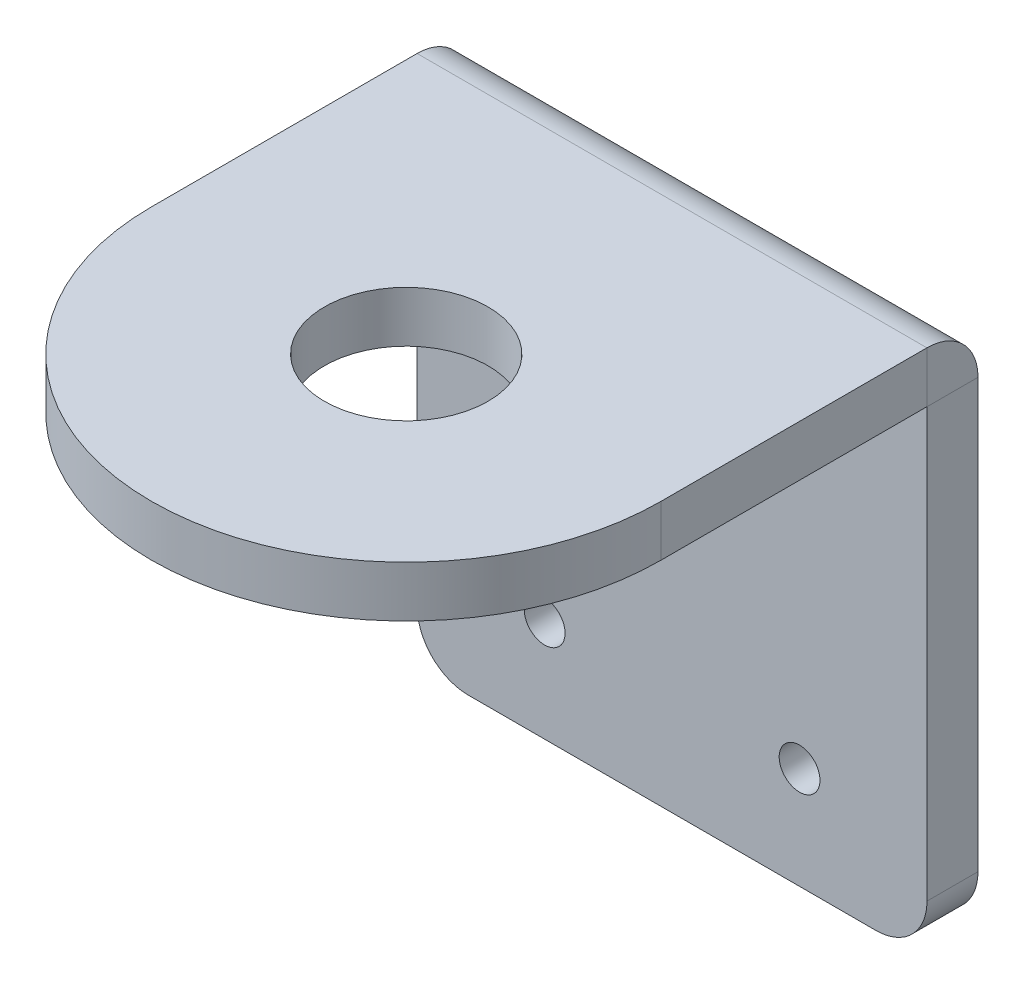
from build123d import *

# Parameters (mm, degrees)
SCHIZZO1_R                           = 8.025
SCHIZZO1_R_2                         = 2
BASE_FLANGIA1_DEPTH                  = 5
PIEGATURA_START                      = -25
PIEGATURA_DELLO_SCHIZZO1_OUTLINE_W   = 50
PIEGATURA_DELLO_SCHIZZO1_OUTLINE_H   = 5
PIEGATURA_DELLO_SCHIZZO1_DEPTH       = 51
PIEGATURA_START_2                    = -30
PIEGATURA_DELLO_SCHIZZO1_2_OUTLINE_R = 8.025
PIEGATURA_DELLO_SCHIZZO1_2_DEPTH     = 5
PIEGATURA_START_3                    = -26
PIEGATURA_DELLO_SCHIZZO1_3_DEPTH     = 51
PIEGATURA_DELLO_SCHIZZO1_4_DEPTH     = 50


with BuildPart() as part:
    # Base-Flangia1: sheet metal written as solids
    # Schizzo1 → Base-Flangia1 (new body)
    with BuildSketch(Plane.XY):
        with BuildLine():
            Line((-25, -72), (-25, 0))
            ThreePointArc((-25, 0), (0, 25), (25, 0))
            Line((25, 0), (25, -72))
            ThreePointArc((25, -72), (23.535533906, -75.535533906), (20, -77))
            Line((20, -77), (-20, -77))
            ThreePointArc((-20, -77), (-23.535533906, -75.535533906), (-25, -72))
        make_face()
        Circle(SCHIZZO1_R, mode=Mode.SUBTRACT)
        with Locations((-12.5, -67)):
            Circle(SCHIZZO1_R_2, mode=Mode.SUBTRACT)
        with Locations((12.5, -67)):
            Circle(SCHIZZO1_R_2, mode=Mode.SUBTRACT)
    extrude(amount=-BASE_FLANGIA1_DEPTH)

    # Piegatura dello schizzo1: read off the stored shape, not the designer's step
    # Piegatura dello schizzo1 outline → Piegatura dello schizzo1 (cut)
    with BuildSketch(Plane(origin=(0, 0, 0), x_dir=(1, 0, 0), z_dir=(0, 1, 0)).offset(PIEGATURA_START)):
        with Locations((0, 2.5)):
            Rectangle(PIEGATURA_DELLO_SCHIZZO1_OUTLINE_W, PIEGATURA_DELLO_SCHIZZO1_OUTLINE_H)
    extrude(amount=PIEGATURA_DELLO_SCHIZZO1_DEPTH, mode=Mode.SUBTRACT)

    # Piegatura dello schizzo1 2 outline → Piegatura dello schizzo1 2 (add)
    with BuildSketch(Plane(origin=(0, 0, 0), x_dir=(1, 0, 0), z_dir=(0, 1, 0)).offset(PIEGATURA_START_2)):
        with BuildLine():
            Line((-25, 0), (-25, -26.07730122))
            ThreePointArc((-25, -26.07730122), (0, -51.07730122), (25, -26.07730122))
            Line((25, -26.07730122), (25, 0))
            Line((25, 0), (-25, 0))
        make_face()
        with Locations((0, -26.07730122)):
            Circle(PIEGATURA_DELLO_SCHIZZO1_2_OUTLINE_R, mode=Mode.SUBTRACT)
    extrude(amount=PIEGATURA_DELLO_SCHIZZO1_2_DEPTH)

    # Piegatura dello schizzo1 3 outline → Piegatura dello schizzo1 3 (cut)
    with BuildSketch(Plane.YZ.offset(PIEGATURA_START_3)):
        with BuildLine():
            ThreePointArc((-25, 0.01), (-26.467395026, -3.532604974), (-30.01, -5))
            Line((-30.01, -5), (-25, -5))
            Line((-25, -5), (-25, 0.01))
        make_face()
    extrude(amount=PIEGATURA_DELLO_SCHIZZO1_3_DEPTH, mode=Mode.SUBTRACT)

    # Piegatura dello schizzo1 4 outline → Piegatura dello schizzo1 4 (add)
    with BuildSketch(Plane.YZ.offset(PIEGATURA_START)):
        with BuildLine():
            ThreePointArc((-30, 0.01), (-30.002928932, 0.002928932), (-30.01, 0))
            Line((-30.01, 0), (-30, 0))
            Line((-30, 0), (-30, 0.01))
        make_face()
    extrude(amount=PIEGATURA_DELLO_SCHIZZO1_4_DEPTH)


solid = part.part
